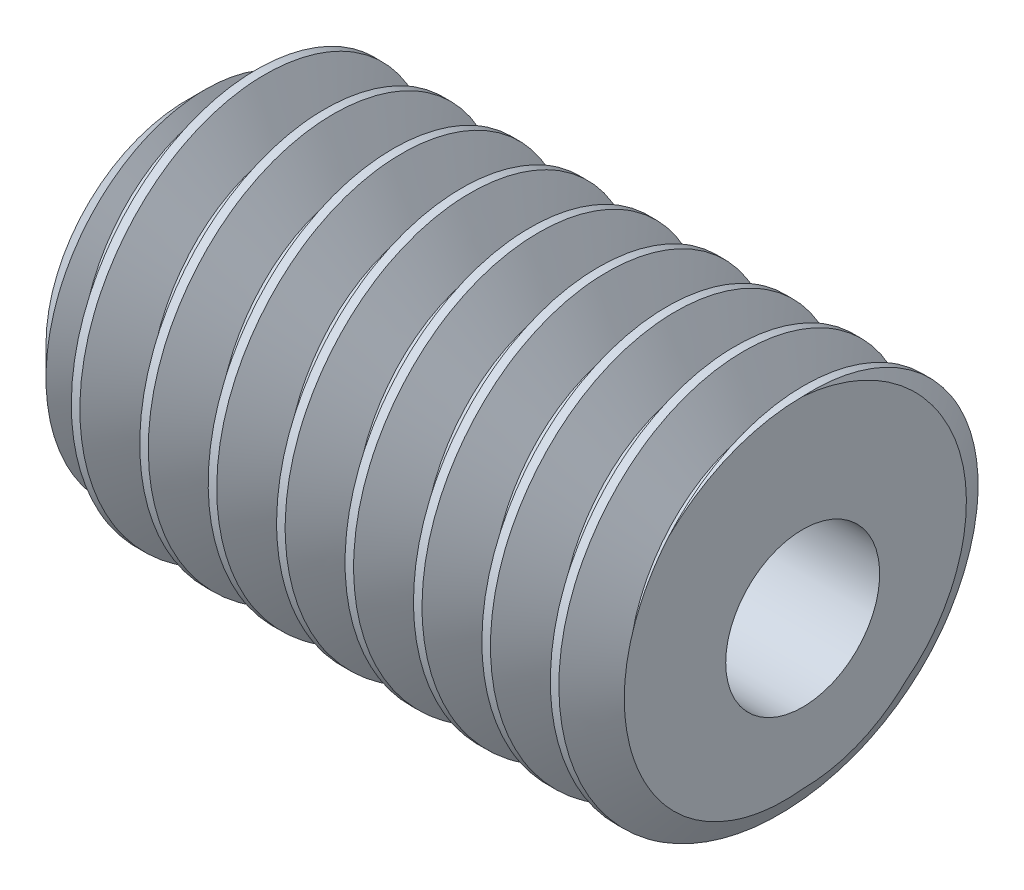
from build123d import *

# Parameters (mm, degrees)
BOSS_EXTRUDE1_DEPTH      = 38.1
BOSS_EXTRUDE1_DEPTH_BACK = 38.1
SKETCH2_R                = 3.9624
CHAMFER1_SIZE            = 1.058333333
CUT_SWEEP3_PITCH         = 1.411111111
SKETCH5_W                = 70.313432737
SKETCH5_H                = 17.582051243
CUT_EXTRUDE1_DEPTH       = 25.4
SKETCH7_R                = 1.5875
CUT_EXTRUDE2_DEPTH       = 14.881326895


with BuildPart() as part:
    # Sketch2 → Boss-Extrude1 (new, two sides: drawn at the far end of the back side and taken through both)
    with BuildSketch(Plane(origin=(0, 0, 0), x_dir=(0, 0, -1), z_dir=(1, 0, 0)).offset(-BOSS_EXTRUDE1_DEPTH_BACK)):
        Circle(SKETCH2_R)
    extrude(amount=BOSS_EXTRUDE1_DEPTH + BOSS_EXTRUDE1_DEPTH_BACK)

    # Chamfer1
    chamfer1_edges = [part.edges().sort_by_distance(p)[0] for p in [
        (-38.1, 0, 3.9624),
        (38.1, 0, 3.9624),
    ]]
    chamfer(chamfer1_edges, length=CHAMFER1_SIZE)

    # Cut-Sweep3: the profile of Sketch4 screwed along a right-hand helix of 55 turns, 6 arcs to a turn; built about Z, then put on its axis
    cut_sweep3_z = Axis((0, 0, 0), (0, 0, 1))
    cut_sweep3_corners = [(3.045856448, 0, -0.529166667), (4.038778629, 0, 0.044097222), (4.038778629, 0, -1.278819444), (3.045856448, 0, -0.705555556)]
    with BuildLine(mode=Mode.PRIVATE) as cut_sweep3_profile:
        Line(cut_sweep3_corners[0], cut_sweep3_corners[1])
        Line(cut_sweep3_corners[1], cut_sweep3_corners[2])
        Line(cut_sweep3_corners[2], cut_sweep3_corners[3])
        Line(cut_sweep3_corners[3], cut_sweep3_corners[0])
    cut_sweep3_cap = Face(cut_sweep3_profile.wire())
    cut_sweep3_turn_angles = [0, 30, 60, 90, 120, 150, 180, 210, 240, 270, 300, 330, 360, 390, 420, 450, 480, 510, 540, 570, 600, 630, 660, 690, 720]
    cut_sweep3_turn_weights = [1, 0.8660254037844387, 1, 0.8660254037844387, 1, 0.8660254037844387, 1, 0.8660254037844387, 1, 0.8660254037844387, 1, 0.8660254037844387, 1, 0.8660254037844387, 1, 0.8660254037844387, 1, 0.8660254037844387, 1, 0.8660254037844387, 1, 0.8660254037844387, 1, 0.8660254037844387, 1]
    cut_sweep3_turn_rails = [Edge.make_bspline([Vector(p[0], p[1], 0).rotate(cut_sweep3_z, cut_sweep3_turn_angles[k]) / cut_sweep3_turn_weights[k] + Vector(0, 0, p[2] + CUT_SWEEP3_PITCH * cut_sweep3_turn_angles[k] / 360) for k in range(25)], [0, 0, 0, 1, 1, 2, 2, 3, 3, 4, 4, 5, 5, 6, 6, 7, 7, 8, 8, 9, 9, 10, 10, 11, 11, 12, 12, 12], 2, cut_sweep3_turn_weights) for p in cut_sweep3_corners]
    cut_sweep3_turn_sides = [Face.make_surface_from_curves(cut_sweep3_turn_rails[p[0]], cut_sweep3_turn_rails[p[1]]) for p in [(0, 1), (1, 2), (2, 3), (3, 0)]]
    cut_sweep3_last_angles = [19440, 19470, 19500, 19530, 19560, 19590, 19620, 19650, 19680, 19710, 19740, 19770, 19800]
    cut_sweep3_last_weights = [1, 0.8660254037844387, 1, 0.8660254037844387, 1, 0.8660254037844387, 1, 0.8660254037844387, 1, 0.8660254037844387, 1, 0.8660254037838354, 1]
    cut_sweep3_last_rails = [Edge.make_bspline([Vector(p[0], p[1], 0).rotate(cut_sweep3_z, cut_sweep3_last_angles[k]) / cut_sweep3_last_weights[k] + Vector(0, 0, p[2] + CUT_SWEEP3_PITCH * cut_sweep3_last_angles[k] / 360) for k in range(13)], [0, 0, 0, 1, 1, 2, 2, 3, 3, 4, 4, 5, 5, 6, 6, 6], 2, cut_sweep3_last_weights) for p in cut_sweep3_corners]
    cut_sweep3_last_sides = [Face.make_surface_from_curves(cut_sweep3_last_rails[p[0]], cut_sweep3_last_rails[p[1]]) for p in [(0, 1), (1, 2), (2, 3), (3, 0)]]
    cut_sweep3 = Plane(origin=(38.1, 0, 0), x_dir=(0, 1, 0), z_dir=(-1, 0, 0)) * Solid(Shell([*[p.moved(Location((0, 0, 2 * CUT_SWEEP3_PITCH * i))) for i in range(27) for p in cut_sweep3_turn_sides], *cut_sweep3_last_sides, cut_sweep3_cap, cut_sweep3_cap.rotate(cut_sweep3_z, 19800).moved(Location((0, 0, CUT_SWEEP3_PITCH * 19800 / 360)))]))
    add(cut_sweep3, mode=Mode.SUBTRACT)

    # Sketch5 → Cut-Extrude1 (cut, symmetric)
    with BuildSketch(Plane.XY):
        with Locations((9.756716368, -1.346799894)):
            Rectangle(SKETCH5_W, SKETCH5_H)
    extrude(amount=CUT_EXTRUDE1_DEPTH, both=True, mode=Mode.SUBTRACT)

    # Sketch7 → Cut-Extrude2 (cut, through all)
    with BuildSketch(Plane.ZY.offset(38.1)):
        Circle(SKETCH7_R)
    extrude(amount=-CUT_EXTRUDE2_DEPTH, mode=Mode.SUBTRACT)


solid = part.part
